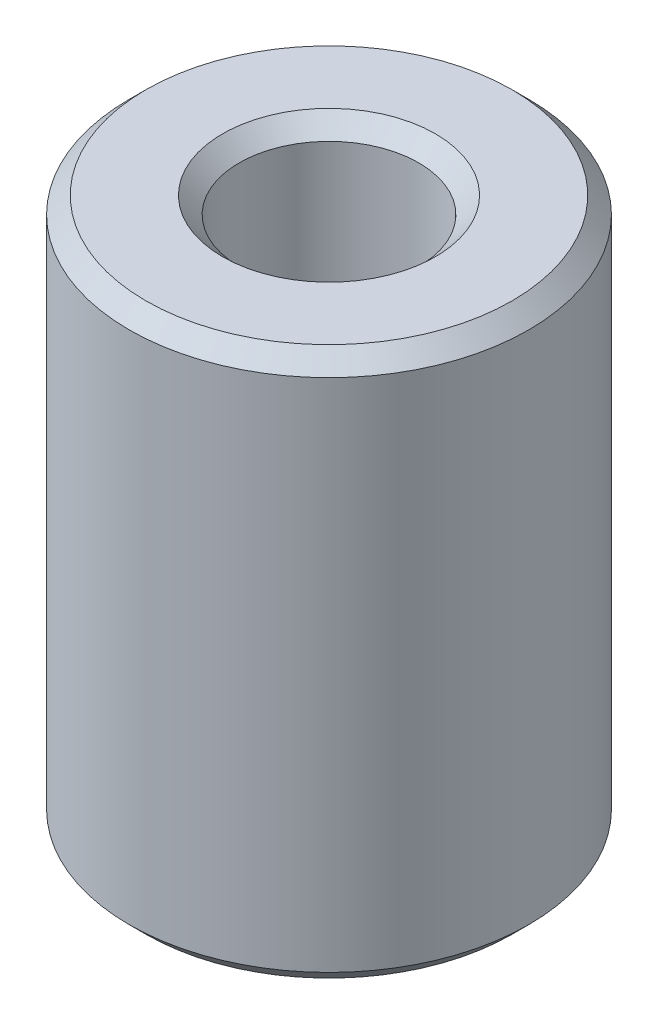
from build123d import *

# Parameters (mm, degrees)
SKETCH1_R           = 15
BOSS_EXTRUDE1_DEPTH = 41.200653754
SKETCH2_R           = 6.740650359
CUT_EXTRUDE1_DEPTH  = 47.3410603
CHAMFER1_SIZE       = 1.256790063


with BuildPart() as part:
    # Sketch1 → Boss-Extrude1 (new body)
    with BuildSketch(Plane(origin=(0, 0, 0), x_dir=(1, 0, 0), z_dir=(0, 1, 0))):
        Circle(SKETCH1_R)
    extrude(amount=BOSS_EXTRUDE1_DEPTH)

    # Sketch2 → Cut-Extrude1 (cut, through all)
    with BuildSketch(Plane(origin=(0, 0, 0), x_dir=(1, 0, 0), z_dir=(0, 1, 0))):
        Circle(SKETCH2_R)
    extrude(amount=CUT_EXTRUDE1_DEPTH, mode=Mode.SUBTRACT)

    # Chamfer1
    chamfer1_edges = [part.edges().sort_by_distance(p)[0] for p in [
        (-6.740650359, 41.200653754, 0),
        (-6.740650359, 0, 0),
        (-15, 0, 0),
        (-15, 41.200653754, 0),
    ]]
    chamfer(chamfer1_edges, length=CHAMFER1_SIZE)


solid = part.part
